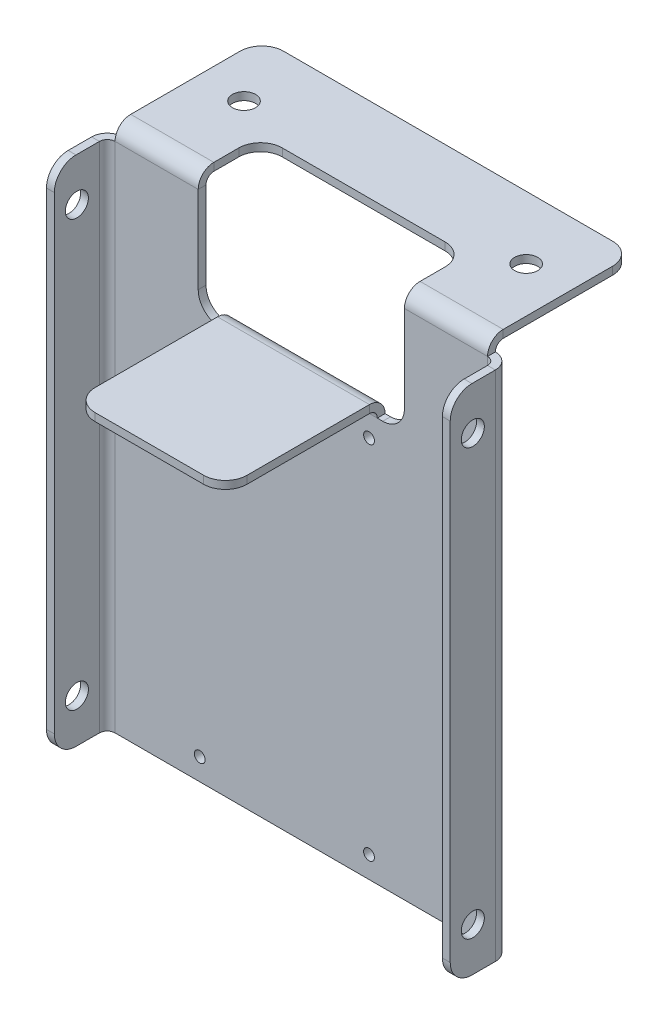
from build123d import *

# Parameters (mm, degrees)
SKETCH1_W                      = 118.11
SKETCH1_H                      = 149.86
BASE_FLANGE1_DEPTH             = 2.286
EDGE_FLANGE1_STRIP_W           = 13.716
EDGE_FLANGE1_STRIP_H           = 2.286
EDGE_FLANGE1_STRIP_CUT_DEPTH   = 149.86
EDGE_FLANGE1_STRIP_2_W         = 13.716
EDGE_FLANGE1_STRIP_2_H         = 2.286
EDGE_FLANGE1_STRIP_CUT_2_DEPTH = 149.86
EDGE_FLANGE1_DEPTH             = 149.86
EDGE_FLANGE1_BEND_DEPTH        = 149.86
EDGE_FLANGE10_DEPTH            = 108.966
EDGE_FLANGE10_START            = 2.286
EDGE_FLANGE10_PROFILE_W        = 108.966
EDGE_FLANGE10_PROFILE_H        = 38.354
EDGE_FLANGE10_PROFILE_R        = 3.3734375
EDGE_FLANGE10_FLAT_DEPTH       = 2.286
UNFOLD6_START                  = -42.926
UNFOLD6_OUTLINE_W              = 108.966
UNFOLD6_OUTLINE_H              = 4.572
UNFOLD6_DEPTH                  = 40.64
UNFOLD6_START_2                = -2.286
UNFOLD6_2_OUTLINE_W            = 108.966
UNFOLD6_2_OUTLINE_H            = 43.740260605
UNFOLD6_2_OUTLINE_R            = 3.3734375
UNFOLD6_2_DEPTH                = 2.286
SKETCH121_W                    = 60.325
SKETCH121_H                    = 50.8
CUT_EXTRUDE3_DEPTH             = 134.454815623
EDGE_FLANGE16_DEPTH            = 44.45
FOLD3_START                    = -54.483
FOLD3_DEPTH                    = 108.966
FOLD3_START_2                  = -37.9015624
FOLD3_2_OUTLINE_W              = 2.286
FOLD3_2_OUTLINE_H              = 24.690260605
FOLD3_2_DEPTH                  = 75.8031248
FOLD3_3_DEPTH                  = 9.8345624
FOLD3_START_3                  = 44.6484376
FOLD3_4_DEPTH                  = 9.8345624
FOLD3_5_DEPTH                  = 24.3205
FOLD3_START_4                  = 30.1625
FOLD3_6_DEPTH                  = 24.3205
FOLD3_START_5                  = 77.216
FOLD3_7_DEPTH                  = 2.286
SKETCH128_R                    = 1.5875
CUT_EXTRUDE4_DEPTH             = 109.553505374
FILLET3_R                      = 6.35
SKETCH130_R                    = 3.3734375
CUT_EXTRUDE6_DEPTH             = 150.152078779


with BuildPart() as part:
    # Base-Flange1: sheet metal written as solids
    # Sketch1 → Base-Flange1 (new body)
    with BuildSketch(Plane.XY):
        Rectangle(SKETCH1_W, SKETCH1_H)
    extrude(amount=-BASE_FLANGE1_DEPTH)

    # Edge-Flange1: sheet metal written as solids
    # Edge-Flange1 strip (on a plane across the edge) → Edge-Flange1 strip cut (cut)
    with BuildSketch(Plane(origin=(-59.055, 74.93, 0), x_dir=(1, 0, 0), z_dir=(0, -1, 0))):
        with Locations((-2.286, -1.143)):
            Rectangle(EDGE_FLANGE1_STRIP_W, EDGE_FLANGE1_STRIP_H)
    extrude(amount=EDGE_FLANGE1_STRIP_CUT_DEPTH, mode=Mode.SUBTRACT)

    # Edge-Flange1 strip 2 (on a plane across the edge) → Edge-Flange1 strip cut 2 (cut)
    with BuildSketch(Plane(origin=(59.055, -74.93, 0), x_dir=(-1, 0, 0), z_dir=(0, 1, 0))):
        with Locations((-2.286, -1.143)):
            Rectangle(EDGE_FLANGE1_STRIP_2_W, EDGE_FLANGE1_STRIP_2_H)
    extrude(amount=EDGE_FLANGE1_STRIP_CUT_2_DEPTH, mode=Mode.SUBTRACT)

    # Edge-Flange1 section (on a plane across the edge) → Edge-Flange1 (add)
    with BuildSketch(Plane(origin=(-59.055, 74.93, 0), x_dir=(1, 0, 0), z_dir=(0, -1, 0))):
        with BuildLine():
            Line((0, 2.286), (0, 15.494))
            Line((0, 15.494), (2.286, 15.494))
            Line((2.286, 15.494), (2.286, 2.286))
            ThreePointArc((2.286, 2.286), (2.955553898, 0.669553898), (4.572, 0))
            Line((4.572, 0), (4.572, -2.286))
            ThreePointArc((4.572, -2.286), (1.339107796, -0.946892204), (0, 2.286))
        make_face()
    extrude(amount=EDGE_FLANGE1_DEPTH)

    # Edge-Flange1 section 2 (on a plane across the edge) → Edge-Flange1 bend (add)
    with BuildSketch(Plane(origin=(59.055, -74.93, 0), x_dir=(-1, 0, 0), z_dir=(0, 1, 0))):
        with BuildLine():
            Line((0, 2.286), (0, 15.494))
            Line((0, 15.494), (2.286, 15.494))
            Line((2.286, 15.494), (2.286, 2.286))
            ThreePointArc((2.286, 2.286), (2.955553898, 0.669553898), (4.572, 0))
            Line((4.572, 0), (4.572, -2.286))
            ThreePointArc((4.572, -2.286), (1.339107796, -0.946892204), (0, 2.286))
        make_face()
    extrude(amount=EDGE_FLANGE1_BEND_DEPTH)

    # Edge-Flange10: sheet metal written as solids
    # Edge-Flange10 bend section (on a plane across the edge) → Edge-Flange10 (add)
    with BuildSketch(Plane(origin=(-54.483, 77.216, -2.286), x_dir=(0, -1, 0), z_dir=(1, 0, 0))):
        with BuildLine():
            Line((-2.286, 2.286), (0, 2.286))
            ThreePointArc((0, 2.286), (0.669553898, 0.669553898), (2.286, 0))
            Line((2.286, 0), (2.286, -2.286))
            ThreePointArc((2.286, -2.286), (-0.946892204, -0.946892204), (-2.286, 2.286))
        make_face()
    extrude(amount=EDGE_FLANGE10_DEPTH)

    # Edge-Flange10 profile (on flange) → Edge-Flange10 flat (add)
    with BuildSketch(Plane(origin=(0, 77.216, -2.286), x_dir=(1, 0, 0), z_dir=(0, 1, 0)).offset(EDGE_FLANGE10_START)):
        with Locations((0, 21.463)):
            Rectangle(EDGE_FLANGE10_PROFILE_W, EDGE_FLANGE10_PROFILE_H)
        with Locations((41.275, 22.225)):
            Circle(EDGE_FLANGE10_PROFILE_R, mode=Mode.SUBTRACT)
        with Locations((-41.275, 22.225)):
            Circle(EDGE_FLANGE10_PROFILE_R, mode=Mode.SUBTRACT)
    extrude(amount=-EDGE_FLANGE10_FLAT_DEPTH)

    # Unfold6: read off the stored shape, not the designer's step
    # Unfold6 outline → Unfold6 (cut)
    with BuildSketch(Plane.XY.offset(UNFOLD6_START)):
        with Locations((0, 77.216)):
            Rectangle(UNFOLD6_OUTLINE_W, UNFOLD6_OUTLINE_H)
    extrude(amount=UNFOLD6_DEPTH, mode=Mode.SUBTRACT)

    # Unfold6 2 outline → Unfold6 2 (add)
    with BuildSketch(Plane.XY.offset(UNFOLD6_START_2)):
        with Locations((0, 96.800130303)):
            Rectangle(UNFOLD6_2_OUTLINE_W, UNFOLD6_2_OUTLINE_H)
        with Locations((-41.275, 100.255260605)):
            Circle(UNFOLD6_2_OUTLINE_R, mode=Mode.SUBTRACT)
        with Locations((41.275, 100.255260605)):
            Circle(UNFOLD6_2_OUTLINE_R, mode=Mode.SUBTRACT)
    extrude(amount=UNFOLD6_2_DEPTH)

    # Sketch121 → Cut-Extrude3 (cut, through all)
    with BuildSketch(Plane.XY):
        with Locations((0, 68.58)):
            Rectangle(SKETCH121_W, SKETCH121_H)
    extrude(amount=-CUT_EXTRUDE3_DEPTH, mode=Mode.SUBTRACT)

    # Edge-Flange16: sheet metal written as solids
    # Edge-Flange16 section (on a plane across the edge) → Edge-Flange16 (add)
    with BuildSketch(Plane(origin=(22.225, 45.466, 0), x_dir=(0, -1, 0), z_dir=(-1, 0, 0))):
        with BuildLine():
            Line((-2.286, 2.286), (-2.286, 44.45))
            Line((-2.286, 44.45), (0, 44.45))
            Line((0, 44.45), (0, 2.286))
            ThreePointArc((0, 2.286), (0.669553898, 0.669553898), (2.286, 0))
            Line((2.286, 0), (2.286, -2.286))
            ThreePointArc((2.286, -2.286), (-0.946892204, -0.946892204), (-2.286, 2.286))
        make_face()
    extrude(amount=EDGE_FLANGE16_DEPTH)

    # Fold3: read off the stored shape, not the designer's step
    # Fold3 outline → Fold3 (cut)
    with BuildSketch(Plane.YZ.offset(FOLD3_START)):
        with BuildLine():
            ThreePointArc((74.93, 0), (77.216, -0.612531854), (78.889468147, -2.286))
            Line((78.889468147, -2.286), (118.670260605, -2.286))
            Line((118.670260605, -2.286), (118.670260605, 0))
            Line((118.670260605, 0), (74.93, 0))
        make_face()
    extrude(amount=FOLD3_DEPTH, mode=Mode.SUBTRACT)

    # Fold3 3 outline → Fold3 3 (add)
    with BuildSketch(Plane.YZ.offset(FOLD3_START)):
        with BuildLine():
            ThreePointArc((74.93, -2.286), (76.546446102, -2.955553898), (77.216, -4.572))
            Line((77.216, -4.572), (77.216, -42.926))
            Line((77.216, -42.926), (79.502, -42.926))
            Line((79.502, -42.926), (79.502, -4.572))
            ThreePointArc((79.502, -4.572), (79.346212878, -3.388679326), (78.889468147, -2.286))
            Line((78.889468147, -2.286), (74.93, -2.286))
        make_face()
    extrude(amount=FOLD3_3_DEPTH)

    # Fold3 4 outline → Fold3 4 (add)
    with BuildSketch(Plane.YZ.offset(FOLD3_START_3)):
        with BuildLine():
            ThreePointArc((74.93, -2.286), (76.546446102, -2.955553898), (77.216, -4.572))
            Line((77.216, -4.572), (77.216, -42.926))
            Line((77.216, -42.926), (79.502, -42.926))
            Line((79.502, -42.926), (79.502, -4.572))
            ThreePointArc((79.502, -4.572), (79.346212878, -3.388679326), (78.889468147, -2.286))
            Line((78.889468147, -2.286), (74.93, -2.286))
        make_face()
    extrude(amount=FOLD3_4_DEPTH)



with BuildPart() as body_2:
    # Fold3 2 outline → Fold3 2 (new body)
    with BuildSketch(Plane.YZ.offset(FOLD3_START_2)):
        with Locations((78.359, -30.580869697)):
            Rectangle(FOLD3_2_OUTLINE_W, FOLD3_2_OUTLINE_H)
    extrude(amount=FOLD3_2_DEPTH)


with BuildPart() as part_1:
    add(part.part)

    add(body_2.part)  # Fold3 5 merges body 2
    # Fold3 5 outline → Fold3 5 (add)
    with BuildSketch(Plane.YZ.offset(FOLD3_START)):
        with BuildLine():
            ThreePointArc((74.93, -2.286), (76.546446102, -2.955553898), (77.216, -4.572))
            Line((77.216, -4.572), (77.216, -18.235739395))
            Line((77.216, -18.235739395), (79.502, -18.235739395))
            Line((79.502, -18.235739395), (79.502, -4.572))
            ThreePointArc((79.502, -4.572), (79.346212878, -3.388679326), (78.889468147, -2.286))
            Line((78.889468147, -2.286), (74.93, -2.286))
        make_face()
    extrude(amount=FOLD3_5_DEPTH)

    # Fold3 6 outline → Fold3 6 (add)
    with BuildSketch(Plane.YZ.offset(FOLD3_START_4)):
        with BuildLine():
            ThreePointArc((74.93, -2.286), (76.546446102, -2.955553898), (77.216, -4.572))
            Line((77.216, -4.572), (77.216, -18.235739395))
            Line((77.216, -18.235739395), (79.502, -18.235739395))
            Line((79.502, -18.235739395), (79.502, -4.572))
            ThreePointArc((79.502, -4.572), (79.346212878, -3.388679326), (78.889468147, -2.286))
            Line((78.889468147, -2.286), (74.93, -2.286))
        make_face()
    extrude(amount=FOLD3_6_DEPTH)

    # Fold3 7 outline → Fold3 7 (add)
    with BuildSketch(Plane(origin=(0, 0, 0), x_dir=(1, 0, 0), z_dir=(0, 1, 0)).offset(FOLD3_START_5)):
        with BuildLine():
            Line((44.6484376, 18.235739395), (44.6484375, 24.511))
            ThreePointArc((44.6484375, 24.511), (41.275, 21.1375625), (37.9015625, 24.511))
            Line((37.9015625, 24.511), (37.9015624, 18.235739395))
            Line((37.9015624, 18.235739395), (44.6484376, 18.235739395))
        make_face()
        with BuildLine():
            Line((-37.9015625, 24.511), (-37.9015624, 42.926))
            Line((-37.9015624, 42.926), (-44.6484376, 42.926))
            Line((-44.6484376, 42.926), (-44.6484375, 24.511))
            ThreePointArc((-44.6484375, 24.511), (-41.275, 27.8844375), (-37.9015625, 24.511))
        make_face()
        with BuildLine():
            ThreePointArc((37.9015625, 24.511), (41.275, 27.8844375), (44.6484375, 24.511))
            Line((44.6484375, 24.511), (44.6484376, 42.926))
            Line((44.6484376, 42.926), (37.9015624, 42.926))
            Line((37.9015624, 42.926), (37.9015625, 24.511))
        make_face()
        with BuildLine():
            Line((-37.9015624, 18.235739395), (-37.9015625, 24.511))
            ThreePointArc((-37.9015625, 24.511), (-41.275, 21.1375625), (-44.6484375, 24.511))
            Line((-44.6484375, 24.511), (-44.6484376, 18.235739395))
            Line((-44.6484376, 18.235739395), (-37.9015624, 18.235739395))
        make_face()
    extrude(amount=FOLD3_7_DEPTH)

    # Sketch128 → Cut-Extrude4 (cut, through all)
    with BuildSketch(Plane.XY):
        with Locations((-29.718, 36.957)):
            Circle(SKETCH128_R)
        with Locations((19.812, 36.957)):
            Circle(SKETCH128_R)
        with Locations((19.812, -68.58)):
            Circle(SKETCH128_R)
        with Locations((-29.718, -68.58)):
            Circle(SKETCH128_R)
    extrude(amount=-CUT_EXTRUDE4_DEPTH, mode=Mode.SUBTRACT)

    # Fillet3
    fillet3_edges = [part_1.edges().sort_by_distance(p)[0] for p in [
        (-57.912, 74.93, 15.494),
        (57.912, -74.93, 15.494),
        (-57.912, -74.93, 15.494),
        (-22.225, 46.609, 44.45),
        (22.225, 46.609, 44.45),
        (-54.483, 78.359, -42.926),
        (54.483, 78.359, -42.926),
        (57.912, 74.93, 15.494),
        (30.1625, 78.359, -18.235739395),
        (-30.1625, 78.359, -18.235739395),
        (-30.1625, 43.18, -1.143),
        (30.1625, 43.18, -1.143),
    ]]
    fillet(fillet3_edges, radius=FILLET3_R)

    # Sketch130 → Cut-Extrude6 (cut, through all)
    with BuildSketch(Plane(origin=(59.055, 0, 0), x_dir=(0, 0, -1), z_dir=(1, 0, 0))):
        with Locations((-8.89, -62.23)):
            Circle(SKETCH130_R)
        with Locations((-8.89, 62.23)):
            Circle(SKETCH130_R)
    extrude(amount=-CUT_EXTRUDE6_DEPTH, mode=Mode.SUBTRACT)


solid = part_1.part
